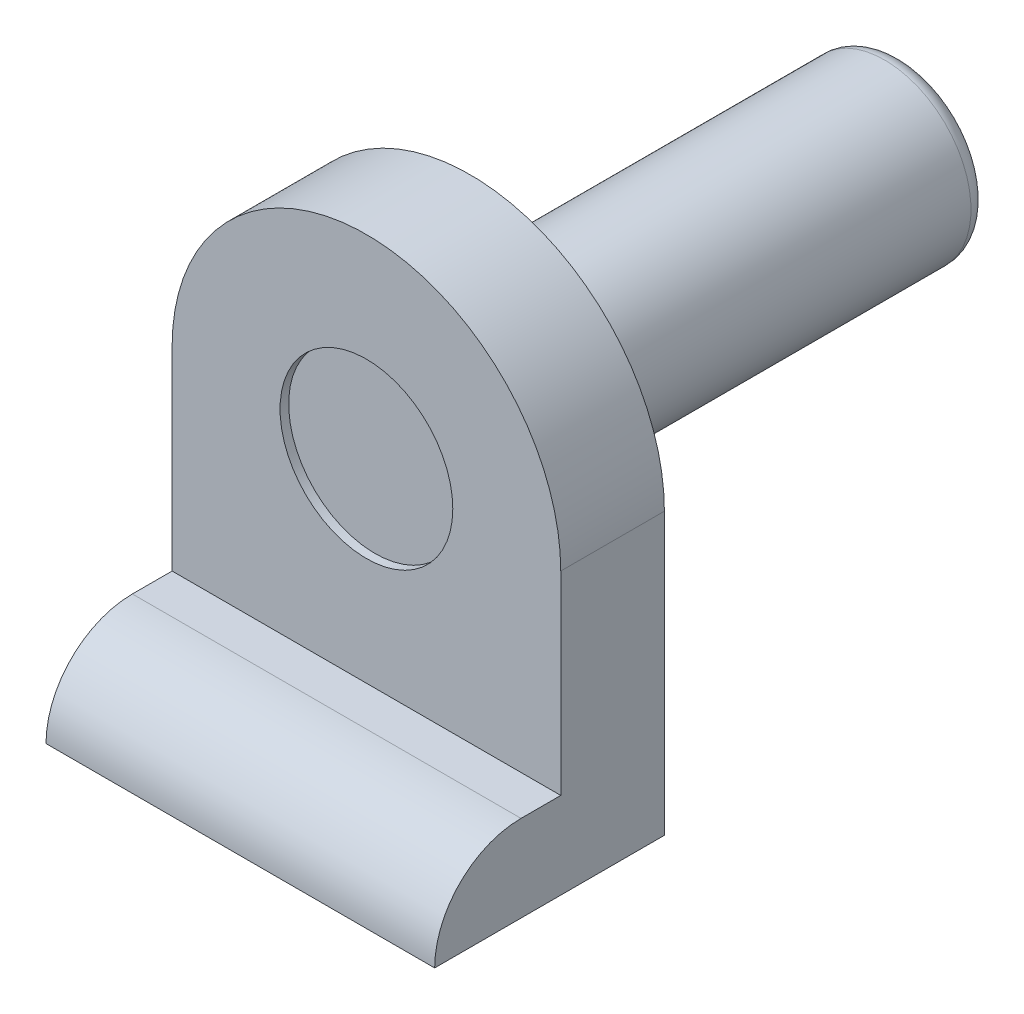
from build123d import *

# Parameters (mm, degrees)
BOSS_EXTRUDE1_DEPTH = 1.2
SKETCH2_W           = 4.5
SKETCH2_H           = 1
BOSS_EXTRUDE2_DEPTH = 2.66
FILLET1_R           = 1
SKETCH3_R           = 1
CUT_EXTRUDE1_DEPTH  = 0.1
SKETCH4_R           = 1
BOSS_EXTRUDE3_DEPTH = 5
FILLET2_R           = 0.2


with BuildPart() as part:
    # Sketch1 → Boss-Extrude1 (new body)
    with BuildSketch(Plane.XY):
        with BuildLine():
            Line((-2.25, 0), (-2.25, -2.25))
            Line((-2.25, -2.25), (2.25, -2.25))
            Line((2.25, -2.25), (2.25, 0))
            ThreePointArc((2.25, 0), (0, 2.25), (-2.25, 0))
        make_face()
    extrude(amount=BOSS_EXTRUDE1_DEPTH)

    # Sketch2 → Boss-Extrude2 (add)
    with BuildSketch(Plane.XY):
        with Locations((0, -2.75)):
            Rectangle(SKETCH2_W, SKETCH2_H)
    extrude(amount=BOSS_EXTRUDE2_DEPTH)

    # Fillet1
    fillet1_edges = [part.edges().sort_by_distance(p)[0] for p in [
        (0, -2.25, 2.66),
    ]]
    fillet(fillet1_edges, radius=FILLET1_R - 0.0001)  # a hair under: the kernel refuses the full size

    # Sketch3 → Cut-Extrude1 (cut)
    with BuildSketch(Plane.XY.offset(1.2)):
        Circle(SKETCH3_R)
    extrude(amount=-CUT_EXTRUDE1_DEPTH, mode=Mode.SUBTRACT)

    # Sketch4 → Boss-Extrude3 (add)
    with BuildSketch(Plane(origin=(0, 0, 0), x_dir=(-1, 0, 0), z_dir=(0, 0, -1))):
        with Locations(Location((0, 0, 0), (0, 0, 180))):
            Circle(SKETCH4_R)
    extrude(amount=BOSS_EXTRUDE3_DEPTH)

    # Fillet2
    fillet2_edges = [part.edges().sort_by_distance(p)[0] for p in [
        (-1, 0, -5),
    ]]
    fillet(fillet2_edges, radius=FILLET2_R)


solid = part.part
